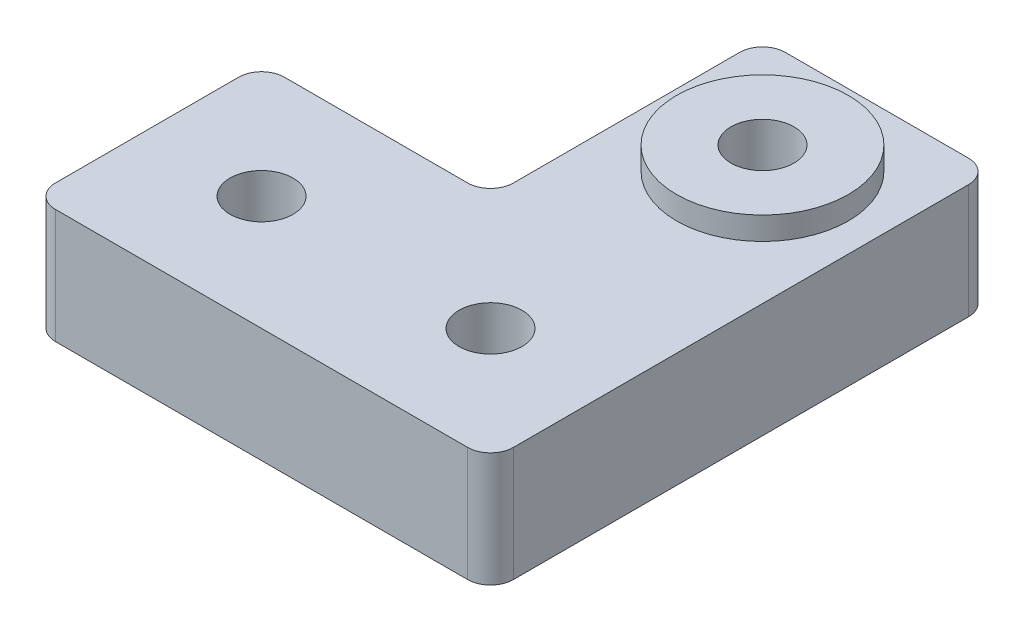
from build123d import *

# Parameters (mm, degrees)
BOSS_EXTRUDE1_DEPTH            = 10
CBORE_FOR_M5_SHCS1_AT_2_COUNT  = 2
CBORE_FOR_M5_SHCS1_AT_2_PITCH  = 20
FILLET1_R                      = 2
CUT_EXTRUDE1_DEPTH             = 4.2
M5_CLEARANCE_HOLE1_D           = 5.5
M5_CLEARANCE_HOLE1_CSINK_D     = 5.55
M5_CLEARANCE_HOLE1_CSINK_ANGLE = 90
BOSS_EXTRUDE2_START            = 2
SKETCH9_R                      = 7.5
SKETCH9_R_2                    = 2.75
BOSS_EXTRUDE2_DEPTH            = 2


with BuildPart() as part:
    # Sketch1 → Boss-Extrude1 (new body)
    with BuildSketch(Plane(origin=(0, 0, 0), x_dir=(1, 0, 0), z_dir=(0, 1, 0))):
        Polygon((0, 0), (40, 0), (40, 43.75), (20, 43.75), (20, 20), (0, 20), align=None)
    extrude(amount=BOSS_EXTRUDE1_DEPTH)

    # Sketch4 → CBORE for M5 SHCS1 (revolve, cut)
    with BuildSketch(Plane(origin=(10, 0, -10), x_dir=(0, 0, -1), z_dir=(1, 0, 0))):
        Polygon((0, 0), (0, 10), (2.75, 10), (2.75, 5), (5, 5), (5, 0.025), (5.025, 0), align=None)
    cbore_for_m5_shcs1 = revolve(axis=Axis((10, -6.35, -10), (0, 1, 0)), mode=Mode.SUBTRACT)

    # CBORE for M5 SHCS1 at 2: CBORE for M5 SHCS1 ×2
    with Locations(*[(i * CBORE_FOR_M5_SHCS1_AT_2_PITCH, 0, 0) for i in range(1, CBORE_FOR_M5_SHCS1_AT_2_COUNT)]):
        add(cbore_for_m5_shcs1, mode=Mode.SUBTRACT)

    # Fillet1
    fillet1_edges = [part.edges().sort_by_distance(p)[0] for p in [
        (20, 5, -20),
        (20, 5, -43.75),
        (40, 5, -43.75),
        (0, 5, -20),
        (0, 5, 0),
        (40, 5, 0),
    ]]
    fillet(fillet1_edges, radius=FILLET1_R)

    # Sketch6 → Cut-Extrude1 (cut)
    with BuildSketch(Plane.XZ):
        Polygon((34.7, -33.75), (32.35, -29.679680602), (27.65, -29.679680602), (25.3, -33.75), (27.65, -37.820319398), (32.35, -37.820319398), align=None)
    extrude(amount=-CUT_EXTRUDE1_DEPTH, mode=Mode.SUBTRACT)

    # M5 Clearance Hole1 (through all)
    with Locations(Plane(origin=(0, 0, 0), x_dir=(-1, 0, 0), z_dir=(0, -1, 0))):
        with Locations((-30, 33.75)):
            CounterSinkHole(M5_CLEARANCE_HOLE1_D / 2, M5_CLEARANCE_HOLE1_CSINK_D / 2, counter_sink_angle=M5_CLEARANCE_HOLE1_CSINK_ANGLE)

    # Sketch9 → Boss-Extrude2 (add)
    with BuildSketch(Plane(origin=(0, 10, 0), x_dir=(1, 0, 0), z_dir=(0, 1, 0)).offset(BOSS_EXTRUDE2_START)):
        with Locations((30, 33.75)):
            Circle(SKETCH9_R)
        with Locations((30, 33.75)):
            Circle(SKETCH9_R_2, mode=Mode.SUBTRACT)
    extrude(amount=-BOSS_EXTRUDE2_DEPTH)


solid = part.part
